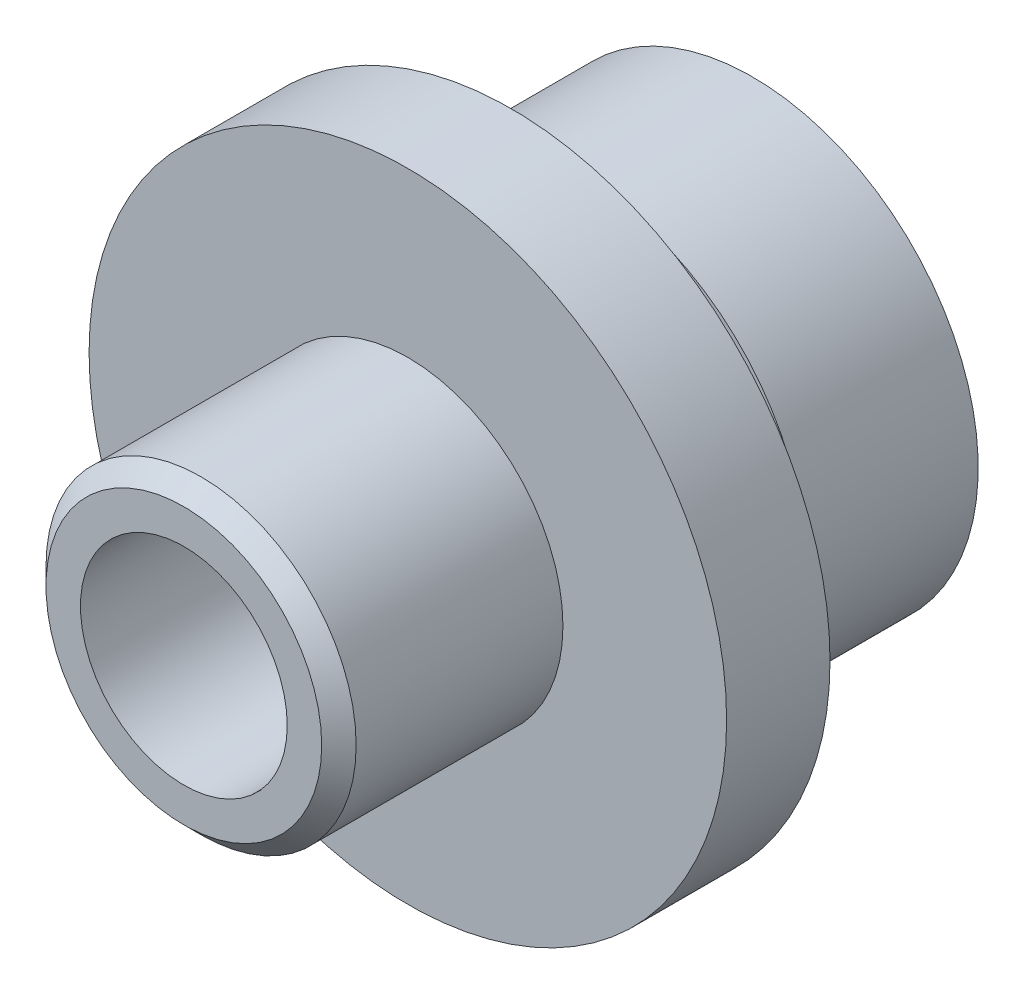
from build123d import *

# Parameters (mm, degrees)
SKETCH1_R           = 9.25
SKETCH1_R_2         = 3
BOSS_EXTRUDE1_DEPTH = 16.5
SKETCH2_OUTSIDE_W   = 26.686
SKETCH2_OUTSIDE_H   = 26.686
SKETCH2_OUTSIDE_R   = 4.5
CUT_EXTRUDE1_DEPTH  = 6.5
SKETCH3_OUTSIDE_W   = 26.686
SKETCH3_OUTSIDE_H   = 26.686
SKETCH3_OUTSIDE_R   = 6.55
CUT_EXTRUDE2_DEPTH  = 7
CUT_EXTRUDE3_START  = -5
SKETCH4_R           = 7.5
SKETCH4_R_2         = 6
CUT_EXTRUDE3_DEPTH  = 3
CHAMFER1_SIZE       = 0.5


with BuildPart() as part:
    # Sketch1 → Boss-Extrude1 (new body)
    with BuildSketch(Plane.XY):
        Circle(SKETCH1_R)
        Circle(SKETCH1_R_2, mode=Mode.SUBTRACT)
    extrude(amount=BOSS_EXTRUDE1_DEPTH)

    # Sketch2 outside → Cut-Extrude1 (cut)
    with BuildSketch(Plane.XY.offset(16.5)):
        Rectangle(SKETCH2_OUTSIDE_W, SKETCH2_OUTSIDE_H)
        Circle(SKETCH2_OUTSIDE_R, mode=Mode.SUBTRACT)
    extrude(amount=-CUT_EXTRUDE1_DEPTH, mode=Mode.SUBTRACT)

    # Sketch3 outside → Cut-Extrude2 (cut)
    with BuildSketch(Plane(origin=(0, 0, 0), x_dir=(-1, 0, 0), z_dir=(0, 0, -1))):
        Rectangle(SKETCH3_OUTSIDE_W, SKETCH3_OUTSIDE_H)
        Circle(SKETCH3_OUTSIDE_R, mode=Mode.SUBTRACT)
    extrude(amount=-CUT_EXTRUDE2_DEPTH, mode=Mode.SUBTRACT)

    # Sketch4 → Cut-Extrude3 (cut)
    with BuildSketch(Plane(origin=(0, 0, 0), x_dir=(-1, 0, 0), z_dir=(0, 0, -1)).offset(CUT_EXTRUDE3_START)):
        Circle(SKETCH4_R)
        Circle(SKETCH4_R_2, mode=Mode.SUBTRACT)
    extrude(amount=-CUT_EXTRUDE3_DEPTH, mode=Mode.SUBTRACT)

    # Chamfer1
    chamfer1_edges = [part.edges().sort_by_distance(p)[0] for p in [
        (-4.5, 0, 16.5),
    ]]
    chamfer(chamfer1_edges, length=CHAMFER1_SIZE)


solid = part.part
